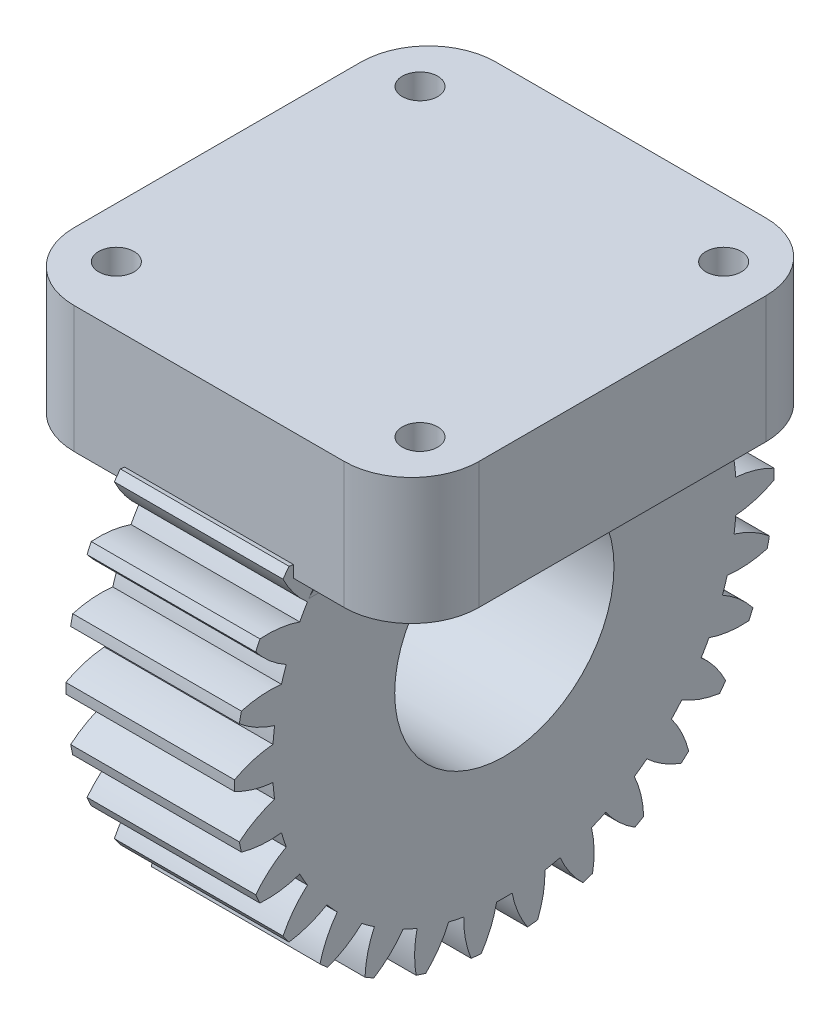
from build123d import *

# Parameters (mm, degrees)
SKETCH1_R                = 13
BOSS_EXTRUDE1_DEPTH      = 20
BOSS_EXTRUDE2_DEPTH      = 14
BOSS_EXTRUDE2_DEPTH_BACK = 34
SKETCH3_W                = 50
SKETCH3_H                = 15
FILLET1_R                = 3
SKETCH4_R                = 2.1
CUT_EXTRUDE3_DEPTH       = 84
FILLET2_R                = 8


with BuildPart() as part:
    # Sketch1 → Boss-Extrude1 (new body)
    with BuildSketch(Plane(origin=(30.485241984, 0, 0), x_dir=(0, 0, -1), z_dir=(1, 0, 0))):
        with BuildLine():
            ThreePointArc((-55.918814129, -6.466857695), (-53.704210116, -7.374209644), (-51.353590463, -7.824038212))
            ThreePointArc((-51.353590463, -7.824038212), (-51.272837127, -8.739161897), (-51.161560896, -9.651077496))
            ThreePointArc((-51.161560896, -9.651077496), (-53.367289252, -10.579797538), (-55.344849776, -11.927763735))
            ThreePointArc((-55.344849776, -11.927763735), (-55.22520275, -12.517907792), (-55.094472534, -13.105696044))
            ThreePointArc((-55.094472534, -13.105696044), (-52.739613854, -13.532778112), (-50.346836262, -13.48405554))
            ThreePointArc((-50.346836262, -13.48405554), (-50.077582668, -14.362392014), (-49.779140175, -15.23124444))
            ThreePointArc((-49.779140175, -15.23124444), (-51.74357632, -16.598266432), (-53.397664471, -18.327934286))
            ThreePointArc((-53.397664471, -18.327934286), (-53.157934171, -18.880306264), (-52.907852675, -19.428069593))
            ThreePointArc((-52.907852675, -19.428069593), (-50.515657952, -19.356216243), (-48.185298283, -18.811071941))
            ThreePointArc((-48.185298283, -18.811071941), (-47.739312105, -19.614233686), (-47.26674672, -20.402049918))
            ThreePointArc((-47.26674672, -20.402049918), (-48.904035368, -22.147628441), (-50.162359556, -24.183403166))
            ThreePointArc((-50.162359556, -24.183403166), (-49.813023346, -24.673861759), (-49.454520331, -25.157660278))
            ThreePointArc((-49.454520331, -25.157660278), (-47.129539954, -24.590011846), (-44.963446109, -23.572271237))
            ThreePointArc((-44.963446109, -23.572271237), (-44.360219082, -24.26515623), (-43.73418418, -24.93750492))
            ThreePointArc((-43.73418418, -24.93750492), (-44.97276796, -26.985349814), (-45.780333381, -29.238258287))
            ThreePointArc((-45.780333381, -29.238258287), (-45.33665893, -29.645368101), (-44.885402697, -30.044057494))
            ThreePointArc((-44.885402697, -30.044057494), (-42.729249465, -29.005422941), (-40.822090138, -27.559566172))
            ThreePointArc((-40.822090138, -27.559566172), (-40.087986179, -28.111892014), (-39.335842488, -28.639388297))
            ThreePointArc((-39.335842488, -28.639388297), (-40.121589347, -30.899998915), (-40.443101516, -33.271578224))
            ThreePointArc((-40.443101516, -33.271578224), (-39.924479526, -33.577546607), (-39.40019214, -33.873702233))
            ThreePointArc((-39.40019214, -33.873702233), (-37.507100295, -32.409474873), (-35.942227501, -30.598692823))
            ThreePointArc((-35.942227501, -30.598692823), (-35.109330474, -30.986320225), (-34.263950284, -31.345909982))
            ThreePointArc((-34.263950284, -31.345909982), (-34.562519313, -33.720486793), (-34.383926605, -36.107087543))
            ThreePointArc((-34.383926605, -36.107087543), (-33.813023346, -36.298542207), (-33.23861868, -36.479220646))
            ThreePointArc((-33.23861868, -36.479220646), (-31.69132542, -34.65339424), (-30.537131609, -32.556826774))
            ThreePointArc((-30.537131609, -32.556826774), (-29.641843112, -32.762814558), (-28.740173593, -32.938781991))
            ThreePointArc((-28.740173593, -32.938781991), (-28.538515892, -35.323544593), (-27.867623666, -37.620860879))
            ThreePointArc((-27.867623666, -37.620860879), (-27.269390351, -37.689434337), (-26.669972645, -37.746739073))
            ThreePointArc((-26.669972645, -37.746739073), (-25.53610211, -35.639110998), (-24.84303109, -33.348388174))
            ThreePointArc((-24.84303109, -33.348388174), (-23.924479526, -33.363733686), (-23.005927963, -33.348388174))
            ThreePointArc((-23.005927963, -33.348388174), (-22.312856942, -35.639110998), (-21.178986408, -37.746739073))
            ThreePointArc((-21.178986408, -37.746739073), (-20.579568702, -37.689434337), (-19.981335386, -37.620860879))
            ThreePointArc((-19.981335386, -37.620860879), (-19.31044316, -35.323544593), (-19.10878546, -32.938781991))
            ThreePointArc((-19.10878546, -32.938781991), (-18.20711594, -32.762814558), (-17.311827444, -32.556826774))
            ThreePointArc((-17.311827444, -32.556826774), (-16.157633632, -34.65339424), (-14.610340373, -36.479220646))
            ThreePointArc((-14.610340373, -36.479220646), (-14.035935706, -36.298542207), (-13.465032448, -36.107087543))
            ThreePointArc((-13.465032448, -36.107087543), (-13.28643974, -33.720486793), (-13.585008769, -31.345909982))
            ThreePointArc((-13.585008769, -31.345909982), (-12.739628578, -30.986320225), (-11.906731552, -30.598692823))
            ThreePointArc((-11.906731552, -30.598692823), (-10.341858758, -32.409474873), (-8.448766913, -33.873702233))
            ThreePointArc((-8.448766913, -33.873702233), (-7.924479526, -33.577546607), (-7.405857537, -33.271578224))
            ThreePointArc((-7.405857537, -33.271578224), (-7.727369705, -30.899998915), (-8.513116564, -28.639388297))
            ThreePointArc((-8.513116564, -28.639388297), (-7.760972873, -28.111892014), (-7.026868914, -27.559566172))
            ThreePointArc((-7.026868914, -27.559566172), (-5.119709587, -29.005422941), (-2.963556355, -30.044057494))
            ThreePointArc((-2.963556355, -30.044057494), (-2.512300123, -29.645368101), (-2.068625672, -29.238258287))
            ThreePointArc((-2.068625672, -29.238258287), (-2.876191092, -26.985349814), (-4.114774873, -24.93750492))
            ThreePointArc((-4.114774873, -24.93750492), (-3.48873997, -24.26515623), (-2.885512943, -23.572271237))
            ThreePointArc((-2.885512943, -23.572271237), (-0.719419098, -24.590011846), (1.605561279, -25.157660278))
            ThreePointArc((1.605561279, -25.157660278), (1.964064294, -24.673861759), (2.313400504, -24.183403166))
            ThreePointArc((2.313400504, -24.183403166), (1.055076316, -22.147628441), (-0.582212332, -20.402049918))
            ThreePointArc((-0.582212332, -20.402049918), (-0.109646947, -19.614233686), (0.336339231, -18.811071941))
            ThreePointArc((0.336339231, -18.811071941), (2.6666989, -19.356216243), (5.058893622, -19.428069593))
            ThreePointArc((5.058893622, -19.428069593), (5.308975118, -18.880306264), (5.548705419, -18.327934286))
            ThreePointArc((5.548705419, -18.327934286), (3.894617268, -16.598266432), (1.930181123, -15.23124444))
            ThreePointArc((1.930181123, -15.23124444), (2.228623615, -14.362392014), (2.49787721, -13.48405554))
            ThreePointArc((2.49787721, -13.48405554), (4.890654802, -13.532778112), (7.245513482, -13.105696044))
            ThreePointArc((7.245513482, -13.105696044), (7.376243697, -12.517907792), (7.495890723, -11.927763735))
            ThreePointArc((7.495890723, -11.927763735), (5.518330199, -10.579797538), (3.312601844, -9.651077496))
            ThreePointArc((3.312601844, -9.651077496), (3.423878075, -8.739161897), (3.50463141, -7.824038212))
            ThreePointArc((3.50463141, -7.824038212), (5.855251064, -7.374209644), (8.069855077, -6.466857695))
            ThreePointArc((8.069855077, -6.466857695), (8.075520474, -5.864733686), (8.069855077, -5.262609677))
            ThreePointArc((8.069855077, -5.262609677), (5.855251064, -4.355257727), (3.50463141, -3.905429159))
            ThreePointArc((3.50463141, -3.905429159), (3.423878075, -2.990305474), (3.312601844, -2.078389875))
            ThreePointArc((3.312601844, -2.078389875), (5.518330199, -1.149669834), (7.495890723, 0.198296363))
            ThreePointArc((7.495890723, 0.198296363), (7.376243697, 0.78844042), (7.245513482, 1.376228673))
            ThreePointArc((7.245513482, 1.376228673), (4.890654802, 1.80331074), (2.49787721, 1.754588169))
            ThreePointArc((2.49787721, 1.754588169), (2.228623615, 2.632924643), (1.930181123, 3.501777069))
            ThreePointArc((1.930181123, 3.501777069), (3.894617268, 4.868799061), (5.548705419, 6.598466915))
            ThreePointArc((5.548705419, 6.598466915), (5.308975118, 7.150838893), (5.058893622, 7.698602221))
            ThreePointArc((5.058893622, 7.698602221), (2.6666989, 7.626748871), (0.336339231, 7.08160457))
            ThreePointArc((0.336339231, 7.08160457), (-0.109646947, 7.884766314), (-0.582212332, 8.672582547))
            ThreePointArc((-0.582212332, 8.672582547), (1.055076316, 10.418161069), (2.313400504, 12.453935795))
            ThreePointArc((2.313400504, 12.453935795), (1.964064294, 12.944394388), (1.605561279, 13.428192907))
            ThreePointArc((1.605561279, 13.428192907), (-0.719419098, 12.860544475), (-2.885512943, 11.842803866))
            ThreePointArc((-2.885512943, 11.842803866), (-3.48873997, 12.535688859), (-4.114774873, 13.208037548))
            ThreePointArc((-4.114774873, 13.208037548), (-2.876191092, 15.255882443), (-2.068625672, 17.508790916))
            ThreePointArc((-2.068625672, 17.508790916), (-2.512300123, 17.91590073), (-2.963556355, 18.314590122))
            ThreePointArc((-2.963556355, 18.314590122), (-5.119709587, 17.275955569), (-7.026868914, 15.8300988))
            ThreePointArc((-7.026868914, 15.8300988), (-7.760972873, 16.382424643), (-8.513116564, 16.909920925))
            ThreePointArc((-8.513116564, 16.909920925), (-7.727369705, 19.170531544), (-7.405857537, 21.542110853))
            ThreePointArc((-7.405857537, 21.542110853), (-7.924479526, 21.848079235), (-8.448766913, 22.144234862))
            ThreePointArc((-8.448766913, 22.144234862), (-10.341858758, 20.680007502), (-11.906731552, 18.869225452))
            ThreePointArc((-11.906731552, 18.869225452), (-12.739628578, 19.256852854), (-13.585008769, 19.616442611))
            ThreePointArc((-13.585008769, 19.616442611), (-13.28643974, 21.991019421), (-13.465032448, 24.377620171))
            ThreePointArc((-13.465032448, 24.377620171), (-14.035935706, 24.569074836), (-14.610340373, 24.749753274))
            ThreePointArc((-14.610340373, 24.749753274), (-16.157633632, 22.923926869), (-17.311827444, 20.827359403))
            ThreePointArc((-17.311827444, 20.827359403), (-18.20711594, 21.033347187), (-19.10878546, 21.20931462))
            ThreePointArc((-19.10878546, 21.20931462), (-19.31044316, 23.594077222), (-19.981335386, 25.891393507))
            ThreePointArc((-19.981335386, 25.891393507), (-20.579568702, 25.959966966), (-21.178986408, 26.017271702))
            ThreePointArc((-21.178986408, 26.017271702), (-22.312856942, 23.909643626), (-23.005927963, 21.618920802))
            ThreePointArc((-23.005927963, 21.618920802), (-23.924479526, 21.634266314), (-24.84303109, 21.618920802))
            ThreePointArc((-24.84303109, 21.618920802), (-25.53610211, 23.909643626), (-26.669972645, 26.017271702))
            ThreePointArc((-26.669972645, 26.017271702), (-27.269390351, 25.959966966), (-27.867623666, 25.891393507))
            ThreePointArc((-27.867623666, 25.891393507), (-28.538515892, 23.594077222), (-28.740173593, 21.20931462))
            ThreePointArc((-28.740173593, 21.20931462), (-29.641843112, 21.033347187), (-30.537131609, 20.827359403))
            ThreePointArc((-30.537131609, 20.827359403), (-31.69132542, 22.923926869), (-33.23861868, 24.749753274))
            ThreePointArc((-33.23861868, 24.749753274), (-33.813023346, 24.569074836), (-34.383926605, 24.377620171))
            ThreePointArc((-34.383926605, 24.377620171), (-34.562519313, 21.991019421), (-34.263950284, 19.616442611))
            ThreePointArc((-34.263950284, 19.616442611), (-35.109330474, 19.256852854), (-35.942227501, 18.869225452))
            ThreePointArc((-35.942227501, 18.869225452), (-37.507100295, 20.680007502), (-39.40019214, 22.144234862))
            ThreePointArc((-39.40019214, 22.144234862), (-39.924479526, 21.848079235), (-40.443101516, 21.542110853))
            ThreePointArc((-40.443101516, 21.542110853), (-40.121589347, 19.170531544), (-39.335842488, 16.909920925))
            ThreePointArc((-39.335842488, 16.909920925), (-40.087986179, 16.382424643), (-40.822090138, 15.8300988))
            ThreePointArc((-40.822090138, 15.8300988), (-42.729249465, 17.275955569), (-44.885402697, 18.314590122))
            ThreePointArc((-44.885402697, 18.314590122), (-45.33665893, 17.91590073), (-45.780333381, 17.508790916))
            ThreePointArc((-45.780333381, 17.508790916), (-44.97276796, 15.255882443), (-43.73418418, 13.208037548))
            ThreePointArc((-43.73418418, 13.208037548), (-44.360219082, 12.535688859), (-44.963446109, 11.842803866))
            ThreePointArc((-44.963446109, 11.842803866), (-47.129539954, 12.860544475), (-49.454520331, 13.428192907))
            ThreePointArc((-49.454520331, 13.428192907), (-49.813023346, 12.944394388), (-50.162359556, 12.453935795))
            ThreePointArc((-50.162359556, 12.453935795), (-48.904035368, 10.418161069), (-47.26674672, 8.672582547))
            ThreePointArc((-47.26674672, 8.672582547), (-47.739312105, 7.884766314), (-48.185298283, 7.08160457))
            ThreePointArc((-48.185298283, 7.08160457), (-50.515657952, 7.626748871), (-52.907852675, 7.698602221))
            ThreePointArc((-52.907852675, 7.698602221), (-53.157934171, 7.150838893), (-53.397664471, 6.598466915))
            ThreePointArc((-53.397664471, 6.598466915), (-51.74357632, 4.868799061), (-49.779140175, 3.501777069))
            ThreePointArc((-49.779140175, 3.501777069), (-50.077582668, 2.632924643), (-50.346836262, 1.754588169))
            ThreePointArc((-50.346836262, 1.754588169), (-52.739613854, 1.80331074), (-55.094472534, 1.376228673))
            ThreePointArc((-55.094472534, 1.376228673), (-55.22520275, 0.78844042), (-55.344849776, 0.198296363))
            ThreePointArc((-55.344849776, 0.198296363), (-53.367289252, -1.149669834), (-51.161560896, -2.078389875))
            ThreePointArc((-51.161560896, -2.078389875), (-51.272837127, -2.990305474), (-51.353590463, -3.905429159))
            ThreePointArc((-51.353590463, -3.905429159), (-53.704210116, -4.355257727), (-55.918814129, -5.262609677))
            ThreePointArc((-55.918814129, -5.262609677), (-55.924479526, -5.864733686), (-55.918814129, -6.466857695))
        make_face()
        with Locations(Location((-23.924479526, -5.864733686, 0), (0, 0, 180))):
            Circle(SKETCH1_R, mode=Mode.SUBTRACT)
    extrude(amount=-BOSS_EXTRUDE1_DEPTH)

    # Sketch3 → Boss-Extrude2 (add, two sides: drawn at the far end of the back side and taken through both)
    with BuildSketch(Plane(origin=(30.485241984, 0, 0), x_dir=(0, 0, -1), z_dir=(1, 0, 0)).offset(-BOSS_EXTRUDE2_DEPTH_BACK)):
        with Locations((-23.924479526, 19.43540008)):
            Rectangle(SKETCH3_W, SKETCH3_H)
    extrude(amount=BOSS_EXTRUDE2_DEPTH + BOSS_EXTRUDE2_DEPTH_BACK)

    # Fillet1
    # the kernel refuses this fillet: 3 mm, written as the material it adds along each edge
    with BuildSketch(Plane(origin=(30.485241984, 11.93540008, -4.536203644), x_dir=(0, -1, 0), z_dir=(0, 0, 1))) as fillet1_piece_1_section:
        with BuildLine():
            CenterArc((FILLET1_R, FILLET1_R), FILLET1_R, 180, 90)
            Line((0, FILLET1_R), (0, 0))
            Line((0, 0), (FILLET1_R, 0))
        make_face()
    fillet1_piece_1 = extrude(amount=56.921366339, mode=Mode.PRIVATE)
    fillet1_piece_1 = fillet1_piece_1 & Plane(origin=(30.856356688, -5.864733686, 23.924479526), x_dir=(0, 0.643933872187738, -0.7650811514142182), z_dir=(1, 0, 0)) * Cylinder(27.499, 126, mode=Mode.PRIVATE)
    add(fillet1_piece_1)
    with BuildSketch(Plane(origin=(10.485241984, 11.93540008, -4.536203644), x_dir=(-1, 0, 0), z_dir=(0, 0, 1))) as fillet1_piece_2_section:
        with BuildLine():
            CenterArc((FILLET1_R, FILLET1_R), FILLET1_R, 180, 90)
            Line((0, FILLET1_R), (0, 0))
            Line((0, 0), (FILLET1_R, 0))
        make_face()
    fillet1_piece_2 = extrude(amount=56.921366339, mode=Mode.PRIVATE)
    fillet1_piece_2 = fillet1_piece_2 & Plane(origin=(10.114127162, -5.864733686, 23.924479526), x_dir=(0, 0.643933872187738, -0.7650811514142182), z_dir=(1, 0, 0)) * Cylinder(27.499, 126, mode=Mode.PRIVATE)
    add(fillet1_piece_2)

    # Sketch4 → Cut-Extrude3 (cut)
    with BuildSketch(Plane(origin=(0, 26.93540008, 0), x_dir=(1, 0, 0), z_dir=(0, 1, 0))):
        with Locations(Location((2.485241984, -5.924479526, 0), (0, 0, 270))):
            Circle(SKETCH4_R)
        with Locations(Location((38.485241984, -5.924479526, 0), (0, 0, 270))):
            Circle(SKETCH4_R)
        with Locations(Location((38.485241984, -41.924479526, 0), (0, 0, 270))):
            Circle(SKETCH4_R)
        with Locations(Location((2.485241984, -41.924479526, 0), (0, 0, 270))):
            Circle(SKETCH4_R)
    extrude(amount=-CUT_EXTRUDE3_DEPTH, mode=Mode.SUBTRACT)

    # Fillet2
    fillet2_edges = [part.edges().sort_by_distance(p)[0] for p in [
        (-3.514758016, 19.43540008, 48.924479526),
        (-3.514758016, 19.43540008, -1.075520474),
        (44.485241984, 19.43540008, 48.924479526),
        (44.485241984, 19.43540008, -1.075520474),
    ]]
    fillet(fillet2_edges, radius=FILLET2_R)


solid = part.part
